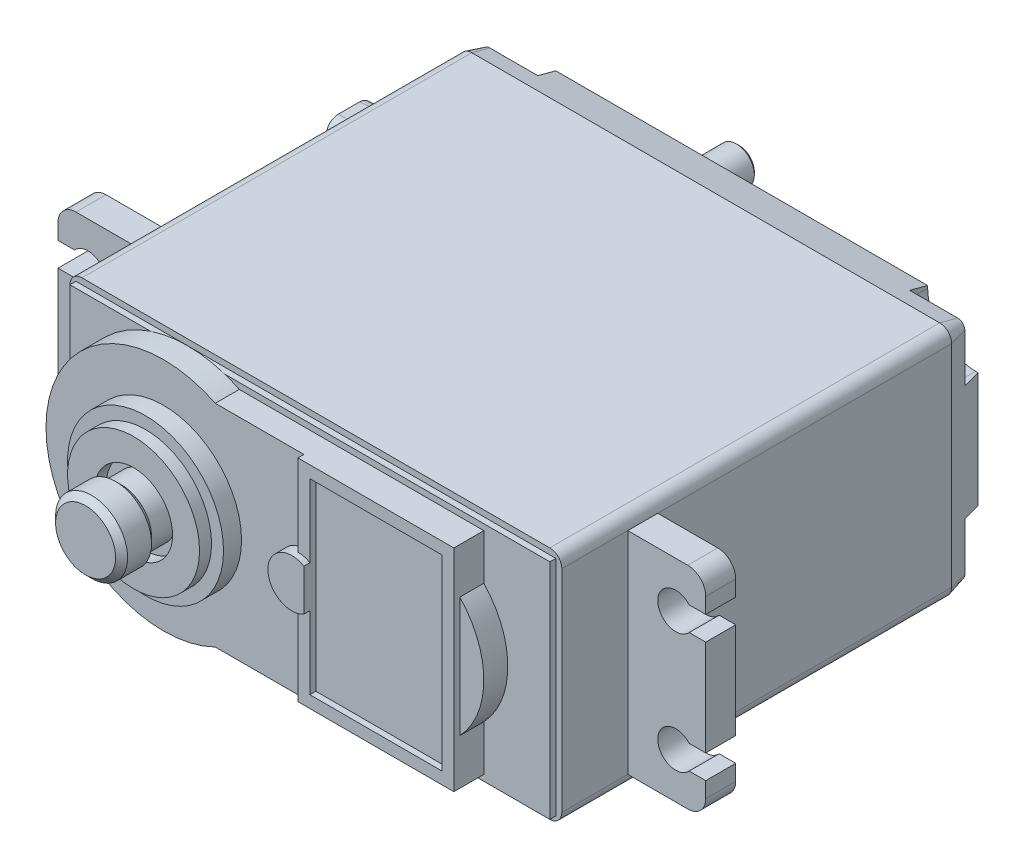
from build123d import *
from OCP.BRepFilletAPI import BRepFilletAPI_MakeChamfer

# Parameters (mm, degrees)
SKETCH1_W            = 41
SKETCH1_H            = 35.5
BOSS_EXTRUDE1_DEPTH  = 19.6
SKETCH5_W            = 2.5
SKETCH5_H            = 17.6
BOSS_EXTRUDE3_DEPTH  = 6.5
CUT_EXTRUDE3_REACH   = 61.501
SKETCH8_W            = 40
SKETCH8_H            = 18.6
BOSS_EXTRUDE4_DEPTH  = 0.5
BOSS_EXTRUDE6_DEPTH  = 2
SKETCH11_W           = 11
SKETCH11_H           = 15.6
BOSS_EXTRUDE7_DEPTH  = 0.5
BOSS_EXTRUDE8_DEPTH  = 0.5
SKETCH13_R           = 6.5
BOSS_EXTRUDE9_DEPTH  = 1.5
SKETCH14_R           = 5.5
BOSS_EXTRUDE10_DEPTH = 1
SKETCH15_R           = 3.25
CUT_EXTRUDE4_DEPTH   = 1
SKETCH16_R           = 2.5
BOSS_EXTRUDE11_DEPTH = 2
SKETCH18_R           = 3
BOSS_EXTRUDE12_DEPTH = 3
SKETCH21_W           = 4.5
SKETCH21_H           = 6.6
BOSS_EXTRUDE13_DEPTH = 7
BOSS_EXTRUDE13_TAPER = 3
FILLET1_R            = 1
FILLET2_R            = 1.5
CHAMFER1_SIZE        = 0.5
CHAMFER2_SIZE        = 0.5
FILLET5_R            = 1
CHAMFER3_SIZE        = 3
CHAMFER3_SIZE2       = 0.803847577
CUT_EXTRUDE5_DEPTH   = 1.5
SKETCH34_R           = 1.5
BOSS_EXTRUDE15_DEPTH = 10
SKETCH35_R           = 1.5
BOSS_EXTRUDE16_DEPTH = 2.5
CHAMFER4_SIZE        = 0.25
CHAMFER5_SIZE        = 0.25


with BuildPart() as part:
    # Sketch1 → Boss-Extrude1 (new body)
    with BuildSketch(Plane(origin=(0, 0, 0), x_dir=(1, 0, 0), z_dir=(0, 1, 0))):
        with Locations((20.5, -17.75)):
            Rectangle(SKETCH1_W, SKETCH1_H)
    extrude(amount=BOSS_EXTRUDE1_DEPTH)

    # Sketch5 → Boss-Extrude3 (add)
    with BuildSketch(Plane(origin=(41, 0, 0), x_dir=(0, 0, -1), z_dir=(1, 0, 0))):
        with Locations((-28.75, 9.8)):
            Rectangle(SKETCH5_W, SKETCH5_H)
    boss_extrude3 = extrude(amount=BOSS_EXTRUDE3_DEPTH)

    # Sketch6 → Cut-Extrude3 (cut, up to next)
    with BuildSketch(Plane.XY.offset(30), mode=Mode.PRIVATE) as cut_extrude3_sk1:
        with BuildLine():
            Line((47.5, 15.8), (46.118033989, 15.8))
            ThreePointArc((46.118033989, 15.8), (43.5, 14.8), (46.118033989, 13.8))
            Line((46.118033989, 13.8), (47.5, 13.8))
            Line((47.5, 13.8), (47.5, 15.8))
        make_face()
    cut_extrude3_tool1 = extrude(cut_extrude3_sk1.sketch, amount=-CUT_EXTRUDE3_REACH, mode=Mode.PRIVATE) & part.part
    # Sketch6 → Cut-Extrude3 (cut, up to next)
    with BuildSketch(Plane.XY.offset(30), mode=Mode.PRIVATE) as cut_extrude3_sk2:
        with BuildLine():
            Line((47.5, 3.8), (47.5, 5.8))
            Line((47.5, 5.8), (46.118033989, 5.8))
            ThreePointArc((46.118033989, 5.8), (43.5, 4.8), (46.118033989, 3.8))
            Line((46.118033989, 3.8), (47.5, 3.8))
        make_face()
    cut_extrude3_tool2 = extrude(cut_extrude3_sk2.sketch, amount=-CUT_EXTRUDE3_REACH, mode=Mode.PRIVATE) & part.part
    cut_extrude3_1 = cut_extrude3_tool1.solids().sort_by_distance((45.465516, 14.8, 30))[0]
    add(cut_extrude3_1, mode=Mode.SUBTRACT)
    cut_extrude3_2 = cut_extrude3_tool2.solids().sort_by_distance((45.465516, 4.8, 30))[0]
    add(cut_extrude3_2, mode=Mode.SUBTRACT)
    cut_extrude3 = cut_extrude3_1 + cut_extrude3_2  # Cut-Extrude3 as one shape, for the pattern or mirror that repeats it

    # Sketch8 → Boss-Extrude4 (add)
    with BuildSketch(Plane.XY.offset(35.5)):
        with Locations((20.5, 9.8)):
            Rectangle(SKETCH8_W, SKETCH8_H)
    extrude(amount=BOSS_EXTRUDE4_DEPTH)

    # Sketch10 → Boss-Extrude6 (add)
    with BuildSketch(Plane.XY.offset(36)):
        with BuildLine():
            Line((35, 18.6), (14.612771731, 18.6))
            ThreePointArc((14.612771731, 18.6), (0.5, 9.8), (14.612771731, 1))
            Line((14.612771731, 1), (35, 1))
            Line((35, 1), (35, 4.8))
            ThreePointArc((35, 4.8), (37, 9.8), (35, 14.8))
            Line((35, 14.8), (35, 18.6))
        make_face()
    extrude(amount=BOSS_EXTRUDE6_DEPTH)

    # Sketch11 → Boss-Extrude7 (add)
    with BuildSketch(Plane.XY.offset(38)):
        with BuildLine():
            Line((22, 18.6), (35, 18.6))
            Line((35, 18.6), (35, 1))
            Line((35, 1), (22, 1))
            Line((22, 1), (22, 7.8))
            ThreePointArc((22, 7.8), (20, 9.8), (22, 11.8))
            Line((22, 11.8), (22, 18.6))
        make_face()
        with Locations((28.5, 9.8)):
            Rectangle(SKETCH11_W, SKETCH11_H, mode=Mode.SUBTRACT)
    extrude(amount=BOSS_EXTRUDE7_DEPTH)

    # Sketch12 → Boss-Extrude8 (add)
    with BuildSketch(Plane.XY.offset(38.5)):
        with BuildLine():
            Line((23, 11.532050808), (23, 8.067949192))
            ThreePointArc((23, 8.067949192), (20, 9.8), (23, 11.532050808))
        make_face()
    extrude(amount=BOSS_EXTRUDE8_DEPTH)

    # Sketch13 → Boss-Extrude9 (add)
    with BuildSketch(Plane.XY.offset(38)):
        with Locations((10.3, 9.8)):
            Circle(SKETCH13_R)
    extrude(amount=BOSS_EXTRUDE9_DEPTH)

    # Sketch14 → Boss-Extrude10 (add)
    with BuildSketch(Plane.XY.offset(39.5)):
        with Locations((10.3, 9.8)):
            Circle(SKETCH14_R)
    extrude(amount=BOSS_EXTRUDE10_DEPTH)

    # Sketch15 → Cut-Extrude4 (cut)
    with BuildSketch(Plane.XY.offset(40.5)):
        with Locations((10.3, 9.8)):
            Circle(SKETCH15_R)
    extrude(amount=-CUT_EXTRUDE4_DEPTH, mode=Mode.SUBTRACT)

    # Mirror1: Boss-Extrude3 across plane
    add(boss_extrude3.mirror(Plane(origin=(20.5, 0, 0), x_dir=(0, 0, 1), z_dir=(1, 0, 0))))

    # Mirror2: Cut-Extrude3 across plane
    add(cut_extrude3.mirror(Plane(origin=(20.5, 0, 0), x_dir=(0, 0, 1), z_dir=(1, 0, 0))), mode=Mode.SUBTRACT)

    # Fillet1
    fillet1_edges = [part.edges().sort_by_distance(p)[0] for p in [
        (41, 19.6, 17.75),
        (0, 19.6, 17.75),
        (41, 0, 17.75),
        (0, 0, 17.75),
    ]]
    fillet(fillet1_edges, radius=FILLET1_R - 0.0001)  # a hair under: the kernel refuses the full size

    # Fillet2
    fillet2_edges = [part.edges().sort_by_distance(p)[0] for p in [
        (-6.5, 18.6, 28.75),
        (-6.5, 1, 28.75),
        (47.5, 1, 28.75),
        (47.5, 18.6, 28.75),
    ]]
    fillet(fillet2_edges, radius=FILLET2_R)

    # Chamfer3: one chamfer whose edges measure the first distance from different faces: ONE call of the kernel's chamfer builder (chamfer() names one face for all edges)
    chamfer3_edges_1 = [part.edges().sort_by_distance(p)[0] for p in [
        (0, 9.8, 0),
    ]]
    chamfer3_side_1 = [part.faces().sort_by_distance(p)[0] for p in [
        (0, 9.8, 16.916676854),
    ]]
    chamfer3_edges_2 = [part.edges().sort_by_distance(p)[0] for p in [
        (20.5, 0, 0),
    ]]
    chamfer3_side_2 = [part.faces().sort_by_distance(p)[0] for p in [
        (20.5, 0, 17.75),
    ]]
    chamfer3_edges_3 = [part.edges().sort_by_distance(p)[0] for p in [
        (20.5, 19.6, 0),
    ]]
    chamfer3_side_3 = [part.faces().sort_by_distance(p)[0] for p in [
        (20.5, 19.6, 17.75),
    ]]
    chamfer3_edges_4 = [part.edges().sort_by_distance(p)[0] for p in [
        (41, 9.8, 0),
    ]]
    chamfer3_side_4 = [part.faces().sort_by_distance(p)[0] for p in [
        (41, 9.8, 16.916676854),
    ]]
    chamfer3_edges_5 = [part.edges().sort_by_distance(p)[0] for p in [
        (40.707136071, 0.292863929, 0),
    ]]
    chamfer3_side_5 = [part.faces().sort_by_distance(p)[0] for p in [
        (40.707136071, 0.292863929, 17.75),
    ]]
    chamfer3_edges_6 = [part.edges().sort_by_distance(p)[0] for p in [
        (40.707136071, 19.307136071, 0),
    ]]
    chamfer3_side_6 = [part.faces().sort_by_distance(p)[0] for p in [
        (40.707136071, 19.307136071, 17.75),
    ]]
    chamfer3_edges_7 = [part.edges().sort_by_distance(p)[0] for p in [
        (0.292863929, 19.307136071, 0),
    ]]
    chamfer3_side_7 = [part.faces().sort_by_distance(p)[0] for p in [
        (0.292863929, 19.307136071, 17.75),
    ]]
    chamfer3_edges_8 = [part.edges().sort_by_distance(p)[0] for p in [
        (0.292863929, 0.292863929, 0),
    ]]
    chamfer3_side_8 = [part.faces().sort_by_distance(p)[0] for p in [
        (0.292863929, 0.292863929, 17.75),
    ]]
    chamfer3 = BRepFilletAPI_MakeChamfer(part.part.solid().wrapped)
    for e in chamfer3_edges_1:
        chamfer3.Add(CHAMFER3_SIZE, CHAMFER3_SIZE2, e.wrapped, chamfer3_side_1[0].wrapped)  # the first distance lies on this face
    for e in chamfer3_edges_2:
        chamfer3.Add(CHAMFER3_SIZE, CHAMFER3_SIZE2, e.wrapped, chamfer3_side_2[0].wrapped)  # the first distance lies on this face
    for e in chamfer3_edges_3:
        chamfer3.Add(CHAMFER3_SIZE, CHAMFER3_SIZE2, e.wrapped, chamfer3_side_3[0].wrapped)  # the first distance lies on this face
    for e in chamfer3_edges_4:
        chamfer3.Add(CHAMFER3_SIZE, CHAMFER3_SIZE2, e.wrapped, chamfer3_side_4[0].wrapped)  # the first distance lies on this face
    for e in chamfer3_edges_5:
        chamfer3.Add(CHAMFER3_SIZE, CHAMFER3_SIZE2, e.wrapped, chamfer3_side_5[0].wrapped)  # the first distance lies on this face
    for e in chamfer3_edges_6:
        chamfer3.Add(CHAMFER3_SIZE, CHAMFER3_SIZE2, e.wrapped, chamfer3_side_6[0].wrapped)  # the first distance lies on this face
    for e in chamfer3_edges_7:
        chamfer3.Add(CHAMFER3_SIZE, CHAMFER3_SIZE2, e.wrapped, chamfer3_side_7[0].wrapped)  # the first distance lies on this face
    for e in chamfer3_edges_8:
        chamfer3.Add(CHAMFER3_SIZE, CHAMFER3_SIZE2, e.wrapped, chamfer3_side_8[0].wrapped)  # the first distance lies on this face
    add(Compound.cast(chamfer3.Shape()), mode=Mode.REPLACE)

    # Sketch22 → Cut-Extrude5 (cut)
    with BuildSketch(Plane(origin=(0, 0, 0), x_dir=(-1, 0, 0), z_dir=(0, 0, -1))):
        with BuildLine():
            Line((0, 19.6), (-5, 19.6))
            Line((-5, 19.6), (-5, 18.6))
            ThreePointArc((-5, 18.6), (-3.828427125, 15.771572875), (-1, 14.6))
            Line((-1, 14.6), (0, 14.6))
            Line((0, 14.6), (0, 19.6))
        make_face()
        with BuildLine():
            Line((0, 5), (0, 0))
            Line((0, 0), (-5, 0))
            Line((-5, 0), (-5, 1))
            ThreePointArc((-5, 1), (-3.828427125, 3.828427125), (-1, 5))
            Line((-1, 5), (0, 5))
        make_face()
        with BuildLine():
            Line((-41, 0), (-36, 0))
            Line((-36, 0), (-36, 1))
            ThreePointArc((-36, 1), (-37.171572875, 3.828427125), (-40, 5))
            Line((-40, 5), (-41, 5))
            Line((-41, 5), (-41, 0))
        make_face()
        with BuildLine():
            Line((-41, 14.6), (-41, 19.6))
            Line((-41, 19.6), (-36, 19.6))
            Line((-36, 19.6), (-36, 18.6))
            ThreePointArc((-36, 18.6), (-37.171572875, 15.771572875), (-40, 14.6))
            Line((-40, 14.6), (-41, 14.6))
        make_face()
    extrude(amount=-CUT_EXTRUDE5_DEPTH, mode=Mode.SUBTRACT)


with BuildPart() as body_2:
    # Sketch16 → Boss-Extrude11 (new body)
    with BuildSketch(Plane.XY.offset(39.5)):
        with Locations((10.3, 9.8)):
            Circle(SKETCH16_R)
    extrude(amount=BOSS_EXTRUDE11_DEPTH)

    # Sketch18 → Boss-Extrude12 (add)
    with BuildSketch(Plane.XY.offset(41.5)):
        with Locations((10.3, 9.8)):
            Circle(SKETCH18_R)
    extrude(amount=BOSS_EXTRUDE12_DEPTH)

    # Chamfer1
    chamfer1_edges = [body_2.edges().sort_by_distance(p)[0] for p in [
        (7.3, 9.8, 44.5),
    ]]
    chamfer(chamfer1_edges, length=CHAMFER1_SIZE)

    # Chamfer2
    chamfer2_edges = [body_2.edges().sort_by_distance(p)[0] for p in [
        (7.3, 9.8, 41.5),
    ]]
    chamfer(chamfer2_edges, length=CHAMFER2_SIZE - 0.0001)  # a hair under: the kernel refuses the full size


with BuildPart() as body_3:
    # Sketch21 → Boss-Extrude13 (new body)
    with BuildSketch(Plane.ZY):
        with Locations((5.25, 9.8)):
            Rectangle(SKETCH21_W, SKETCH21_H)
    extrude(amount=BOSS_EXTRUDE13_DEPTH, taper=BOSS_EXTRUDE13_TAPER)

    # Fillet5
    fillet5_edges = [body_3.edges().sort_by_distance(p)[0] for p in [
        (-3.5, 12.916572773, 3.183427227),
        (-3.5, 12.916572773, 7.316572773),
        (-3.5, 6.683427227, 7.316572773),
        (-3.5, 6.683427227, 3.183427227),
    ]]
    fillet(fillet5_edges, radius=FILLET5_R)


with BuildPart() as body_4:
    # Sketch34 → Boss-Extrude15 (new body)
    with BuildSketch(Plane(origin=(0, 0, 0), x_dir=(-1, 0, 0), z_dir=(0, 0, -1))):
        with Locations((-10.3, 9.8)):
            Circle(SKETCH34_R)
    extrude(amount=BOSS_EXTRUDE15_DEPTH)

    # Chamfer4
    chamfer4_edges = [body_4.edges().sort_by_distance(p)[0] for p in [
        (11.8, 9.8, -10),
    ]]
    chamfer(chamfer4_edges, length=CHAMFER4_SIZE)


with BuildPart() as body_5:
    # Sketch35 → Boss-Extrude16 (new body)
    with BuildSketch(Plane(origin=(0, 0, 0), x_dir=(-1, 0, 0), z_dir=(0, 0, -1))):
        Polygon((-7.55, 11.38771324), (-10.3, 12.975426481), (-13.05, 11.38771324), (-13.05, 8.21228676), (-10.3, 6.624573519), (-7.55, 8.21228676), align=None)
        with Locations((-10.3, 9.8)):
            Circle(SKETCH35_R, mode=Mode.SUBTRACT)
    extrude(amount=BOSS_EXTRUDE16_DEPTH)

    # Chamfer5
    chamfer5_edges = [body_5.edges().sort_by_distance(p)[0] for p in [
        (11.675, 12.18156986, -2.5),
        (13.05, 9.8, -2.5),
        (11.675, 7.41843014, -2.5),
        (8.925, 7.41843014, -2.5),
        (7.55, 9.8, -2.5),
        (8.925, 7.41843014, 0),
        (11.675, 7.41843014, 0),
        (13.05, 9.8, 0),
        (8.925, 12.18156986, -2.5),
        (11.675, 12.18156986, 0),
        (8.925, 12.18156986, 0),
        (7.55, 9.8, 0),
    ]]
    chamfer(chamfer5_edges, length=CHAMFER5_SIZE)


solid = Compound([part.part, body_2.part, body_3.part, body_4.part, body_5.part])
